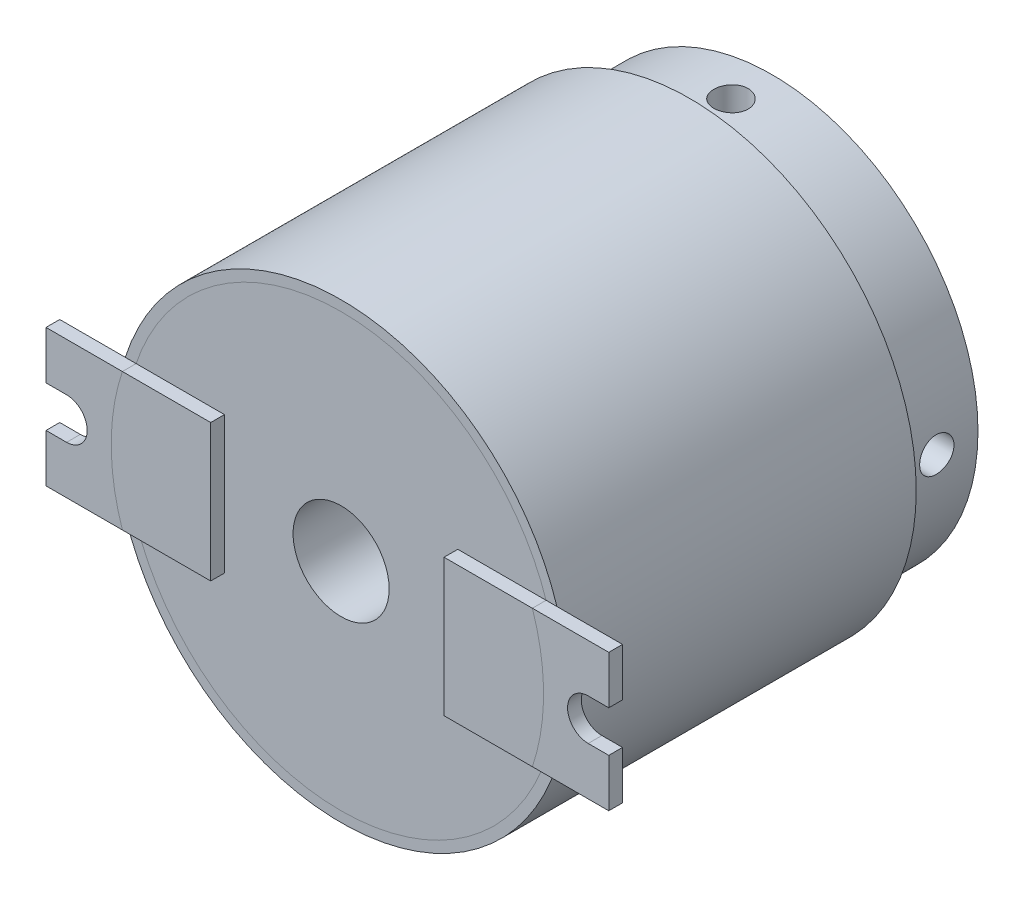
from build123d import *

# Parameters (mm, degrees)
SKETCH_1_R                   = 16.5
EXTRUDE_1_DEPTH              = 25.4
CUT_EXTRUDE_1_REACH          = 36.491
SKETCH_2_R                   = 3.5
SKETCH_3_R                   = 15
SKETCH_3_R_2                 = 3.5
EXTRUDE_2_DEPTH              = 6
SKETCH_7_W                   = 12
SKETCH_7_H                   = 10
EXTRUDE_6_DEPTH              = 1
CUT_EXTRUDE_3_DEPTH          = 1
SPLIT_START                  = -6
SPLIT_BODIES_2_OUTLINE_R     = 15
SPLIT_BODIES_2_OUTLINE_R_2   = 3.5
SPLIT_BODIES_2_DEPTH         = 6
SPLIT_BODIES_2_2_OUTLINE_R   = 15.75
SPLIT_BODIES_2_2_OUTLINE_R_2 = 3.5
SPLIT_BODIES_2_2_DEPTH       = 25.4
SPLIT_BODIES_2_3_OUTLINE_R   = 16.5
SPLIT_BODIES_2_3_OUTLINE_R_2 = 3.5
SPLIT_BODIES_2_3_DEPTH       = 31.4
SPLIT_START_2                = 25.4
SPLIT_BODIES_2_4_DEPTH       = 1
SPLIT_BODIES_2_5_DEPTH       = 1
SPLIT_BODIES_2_6_DEPTH       = 1
SPLIT_BODIES_2_7_DEPTH       = 1
SPLIT_BODIES_2_8_OUTLINE_R   = 16.5
SPLIT_BODIES_2_8_OUTLINE_R_2 = 15.75
SPLIT_BODIES_2_8_DEPTH       = 25.4
SKETCH_11_R                  = 1.25
CUT_EXTRUDE_4_DEPTH          = 38.275461097
PATTERN_CIRCULAR_1_COUNT     = 2
PATTERN_CIRCULAR_1_ANGLE     = 90


# Read off the part's stored shape, not the designer's step: 分割2
with BuildPart() as part:
    # 草圖1 → 填料-伸長1 (new body)
    with BuildSketch(Plane.XY):
        Circle(SKETCH_1_R)
    extrude(amount=EXTRUDE_1_DEPTH)

    # 草圖2 → 除料-伸長1 (cut, up to next)
    with BuildSketch(Plane.XY.offset(25.4), mode=Mode.PRIVATE) as cut_extrude_1_sk1:
        Circle(SKETCH_2_R)
    cut_extrude_1_tool1 = extrude(cut_extrude_1_sk1.sketch, amount=-CUT_EXTRUDE_1_REACH, mode=Mode.PRIVATE) & part.part
    add(cut_extrude_1_tool1.solids().sort_by_distance((0, 0, 25.4))[0], mode=Mode.SUBTRACT)

    # 草圖3 → 填料-伸長2 (add)
    with BuildSketch(Plane(origin=(0, 0, 0), x_dir=(-1, 0, 0), z_dir=(0, 0, -1))):
        Circle(SKETCH_3_R)
        with Locations(Location((0, 0, 0), (0, 0, 180))):
            Circle(SKETCH_3_R_2, mode=Mode.SUBTRACT)
    extrude(amount=EXTRUDE_2_DEPTH)

    # 草圖7 → 填料-伸長6 (add)
    with BuildSketch(Plane.XY.offset(25.4)):
        with Locations((-14.5, 0)):
            Rectangle(SKETCH_7_W, SKETCH_7_H)
    extrude_6 = extrude(amount=EXTRUDE_6_DEPTH)

    # 草圖8 → 除料-伸長3 (cut)
    with BuildSketch(Plane.XY.offset(26.4)):
        with BuildLine():
            Line((-19, 1.5), (-20.5, 1.5))
            Line((-20.5, 1.5), (-20.5, -1.5))
            Line((-20.5, -1.5), (-19, -1.5))
            ThreePointArc((-19, -1.5), (-17.5, 0), (-19, 1.5))
        make_face()
    cut_extrude_3 = extrude(amount=-CUT_EXTRUDE_3_DEPTH, mode=Mode.SUBTRACT)

    # 鏡射2: 填料-伸長6, 除料-伸長3 across plane
    add(extrude_6.mirror(Plane(origin=(0, 0, 0), x_dir=(0, 0, 1), z_dir=(1, 0, 0))))
    add(cut_extrude_3.mirror(Plane(origin=(0, 0, 0), x_dir=(0, 0, 1), z_dir=(1, 0, 0))), mode=Mode.SUBTRACT)

    # Split Bodies 2 3 outline → Split Bodies 2 3 (cut)
    with BuildSketch(Plane.XY.offset(SPLIT_START)):
        Circle(SPLIT_BODIES_2_3_OUTLINE_R)
        Circle(SPLIT_BODIES_2_3_OUTLINE_R_2, mode=Mode.SUBTRACT)
    extrude(amount=SPLIT_BODIES_2_3_DEPTH, mode=Mode.SUBTRACT)

    # Split Bodies 2 4 outline → Split Bodies 2 4 (cut)
    with BuildSketch(Plane.XY.offset(SPLIT_START_2)):
        with BuildLine():
            ThreePointArc((-14.935277031, -5), (-15.75, 0), (-14.935277031, 5))
            Line((-14.935277031, 5), (-20.5, 5))
            Line((-20.5, 5), (-20.5, 1.5))
            Line((-20.5, 1.5), (-19, 1.5))
            ThreePointArc((-19, 1.5), (-17.5, 0), (-19, -1.5))
            Line((-19, -1.5), (-20.5, -1.5))
            Line((-20.5, -1.5), (-20.5, -5))
            Line((-20.5, -5), (-14.935277031, -5))
        make_face()
        with BuildLine():
            Line((8.5, -5), (20.5, -5))
            Line((20.5, -5), (20.5, -1.5))
            Line((20.5, -1.5), (19, -1.5))
            ThreePointArc((19, -1.5), (17.5, 0), (19, 1.5))
            Line((19, 1.5), (20.5, 1.5))
            Line((20.5, 1.5), (20.5, 5))
            Line((20.5, 5), (8.5, 5))
            Line((8.5, 5), (8.5, -5))
        make_face()
    extrude(amount=SPLIT_BODIES_2_4_DEPTH, mode=Mode.SUBTRACT)


with BuildPart() as body_2:
    # Split Bodies 2 outline → Split Bodies 2 (new body)
    with BuildSketch(Plane.XY.offset(SPLIT_START)):
        Circle(SPLIT_BODIES_2_OUTLINE_R)
        Circle(SPLIT_BODIES_2_OUTLINE_R_2, mode=Mode.SUBTRACT)
    extrude(amount=SPLIT_BODIES_2_DEPTH)

    # 草圖11 → 除料-伸長4 (cut, symmetric)
    with BuildSketch(Plane(origin=(0, 0, 0), x_dir=(1, 0, 0), z_dir=(0, 1, 0))):
        with Locations(Location((0, 3, 0), (0, 0, 270))):
            Circle(SKETCH_11_R)
    cut_extrude_4 = extrude(amount=CUT_EXTRUDE_4_DEPTH, both=True, mode=Mode.SUBTRACT)

    # 環狀複製排列1: 除料-伸長4 ×2 about axis
    pattern_circular_1_axis = Axis((0, 0, -6), (0, 0, -1))
    for i in range(1, PATTERN_CIRCULAR_1_COUNT):
        add(cut_extrude_4.rotate(pattern_circular_1_axis, i * PATTERN_CIRCULAR_1_ANGLE / (PATTERN_CIRCULAR_1_COUNT - 1)), mode=Mode.SUBTRACT)


with BuildPart() as body_3:
    # Split Bodies 2 2 outline → Split Bodies 2 2 (new body)
    with BuildSketch(Plane.XY):
        Circle(SPLIT_BODIES_2_2_OUTLINE_R)
        Circle(SPLIT_BODIES_2_2_OUTLINE_R_2, mode=Mode.SUBTRACT)
    extrude(amount=SPLIT_BODIES_2_2_DEPTH)


with BuildPart() as body_4:
    # Split Bodies 2 5 outline → Split Bodies 2 5 (new body)
    with BuildSketch(Plane.XY.offset(SPLIT_START_2)):
        with BuildLine():
            Line((-20.5, -5), (-14.935277031, -5))
            ThreePointArc((-14.935277031, -5), (-15.75, 0), (-14.935277031, 5))
            Line((-14.935277031, 5), (-20.5, 5))
            Line((-20.5, 5), (-20.5, 1.5))
            Line((-20.5, 1.5), (-19, 1.5))
            ThreePointArc((-19, 1.5), (-17.5, 0), (-19, -1.5))
            Line((-19, -1.5), (-20.5, -1.5))
            Line((-20.5, -1.5), (-20.5, -5))
        make_face()
    extrude(amount=SPLIT_BODIES_2_5_DEPTH)


with BuildPart() as body_5:
    # Split Bodies 2 6 outline → Split Bodies 2 6 (new body)
    with BuildSketch(Plane.XY.offset(SPLIT_START_2)):
        with BuildLine():
            Line((20.5, 5), (14.935277031, 5))
            ThreePointArc((14.935277031, 5), (15.75, 0), (14.935277031, -5))
            Line((14.935277031, -5), (20.5, -5))
            Line((20.5, -5), (20.5, -1.5))
            Line((20.5, -1.5), (19, -1.5))
            ThreePointArc((19, -1.5), (17.5, 0), (19, 1.5))
            Line((19, 1.5), (20.5, 1.5))
            Line((20.5, 1.5), (20.5, 5))
        make_face()
    extrude(amount=SPLIT_BODIES_2_6_DEPTH)


with BuildPart() as body_6:
    # Split Bodies 2 7 outline → Split Bodies 2 7 (new body)
    with BuildSketch(Plane.XY.offset(SPLIT_START_2)):
        with BuildLine():
            ThreePointArc((14.935277031, -5), (15.75, 0), (14.935277031, 5))
            Line((14.935277031, 5), (8.5, 5))
            Line((8.5, 5), (8.5, -5))
            Line((8.5, -5), (14.935277031, -5))
        make_face()
    extrude(amount=SPLIT_BODIES_2_7_DEPTH)


with BuildPart() as body_7:
    # Split Bodies 2 8 outline → Split Bodies 2 8 (new body)
    with BuildSketch(Plane.XY):
        Circle(SPLIT_BODIES_2_8_OUTLINE_R)
        Circle(SPLIT_BODIES_2_8_OUTLINE_R_2, mode=Mode.SUBTRACT)
    extrude(amount=SPLIT_BODIES_2_8_DEPTH)


solid = Compound([part.part, body_2.part, body_3.part, body_4.part, body_5.part, body_6.part, body_7.part])
